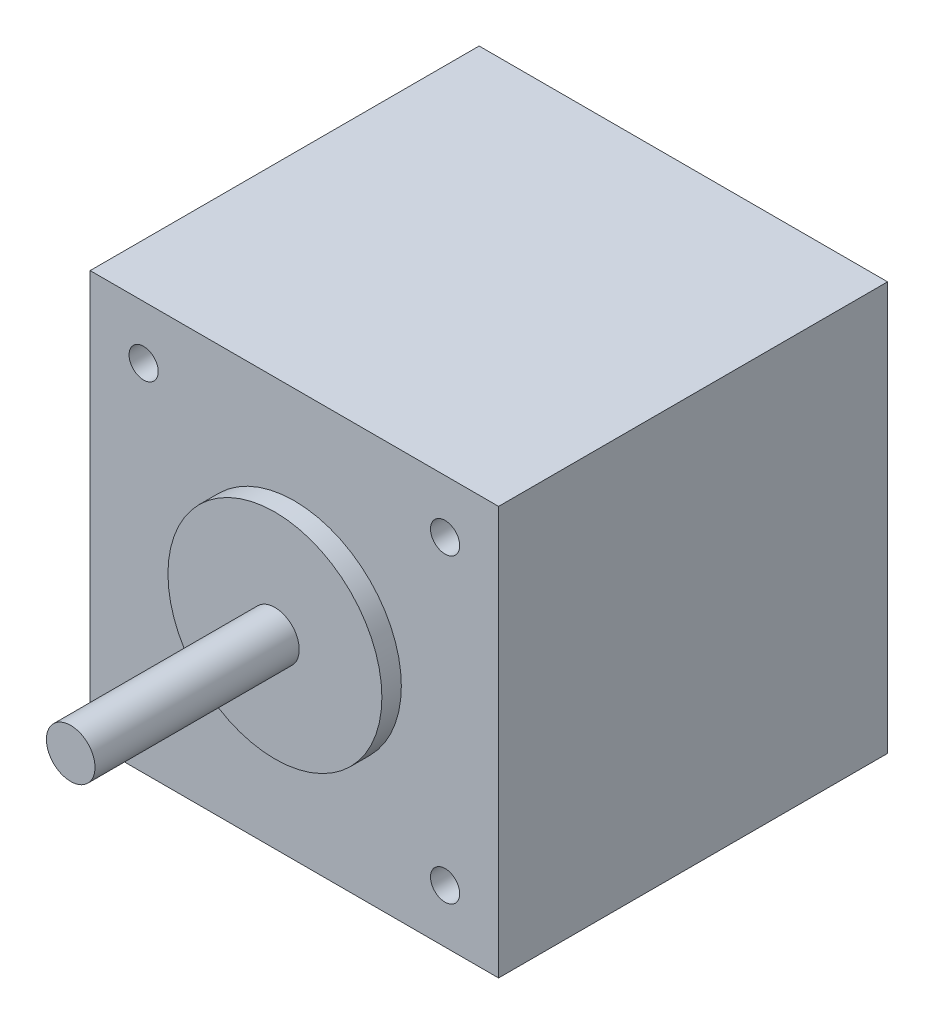
from build123d import *

# Parameters (mm, degrees)
SKETCH_1_W          = 42
SKETCH_1_H          = 42
EXTRUDE_1582_DEPTH  = 40
SKETCH_2_R          = 2.5
EXTRUDE_1637_DEPTH  = 63
SKETCH_3_R          = 11
EXTRUDE_1684_DEPTH  = 42
CUT_EXTRUDE_START   = 40
SKETCH_4_R          = 1.5
CUT_EXTRUDE_3_DEPTH = 4.5


with BuildPart() as part:
    # Эскиз1 → Extrude 1582 (new body)
    with BuildSketch(Plane.XY):
        Rectangle(SKETCH_1_W, SKETCH_1_H)
    extrude(amount=EXTRUDE_1582_DEPTH)

    # Эскиз2 → Extrude 1637 (add)
    with BuildSketch(Plane.XY):
        Circle(SKETCH_2_R)
    extrude(amount=EXTRUDE_1637_DEPTH)

    # Эскиз3 → Extrude 1684 (add)
    with BuildSketch(Plane.XY):
        Circle(SKETCH_3_R)
    extrude(amount=EXTRUDE_1684_DEPTH)

    # Эскиз4 → Крепеж_М3_ПРЕДВ (cut)
    with BuildSketch(Plane.XY.offset(CUT_EXTRUDE_START)):
        with Locations((-15.5, -15.5)):
            Circle(SKETCH_4_R)
        with Locations((-15.5, 15.5)):
            Circle(SKETCH_4_R)
        with Locations((15.5, -15.5)):
            Circle(SKETCH_4_R)
        with Locations((15.5, 15.5)):
            Circle(SKETCH_4_R)
    extrude(amount=-CUT_EXTRUDE_3_DEPTH, mode=Mode.SUBTRACT)


solid = part.part
